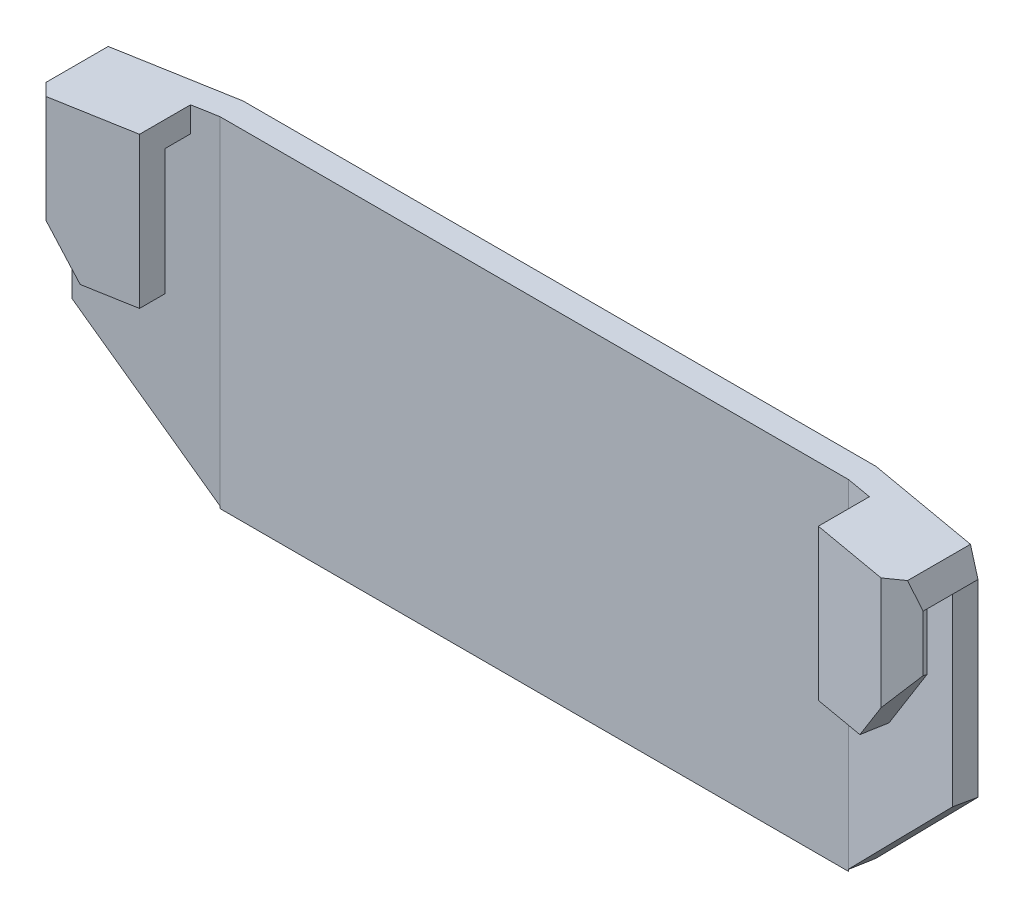
from build123d import *
from OCP.BRepFilletAPI import BRepFilletAPI_MakeChamfer

# Parameters (mm, degrees)
BOSS_EXTRUDE1_DEPTH = 2
BOSS_EXTRUDE2_DEPTH = 25
BOSS_EXTRUDE3_DEPTH = 10
CUT_EXTRUDE4_DEPTH  = 2
CUT_EXTRUDE5_DEPTH  = 2
CUT_EXTRUDE6_DEPTH  = 2
CUT_EXTRUDE7_DEPTH  = 2
CHAMFER1_SIZE       = 0.727940469
CHAMFER1_SIZE_2     = 2
CHAMFER2_SIZE       = 2
CHAMFER2_SIZE2      = 1.72643598


with BuildPart() as part:
    # Sketch12 → Boss-Extrude1 (new body)
    with BuildSketch(Plane(origin=(0, 0, 0), x_dir=(1, 0, 0), z_dir=(0, 1, 0))):
        Polygon((-27, -6.414360409), (-27, -2.352653961), (-25, -2), (25, -2), (27, -2.352653961), (27, -6.414360409), (35.023054857, -7.829041448), (35.023054857, -1.736481777), (25.174977327, 0), (-25.174977327, 0), (-35.023054857, -1.736481777), (-35.023054857, -7.829041448), align=None)
    extrude(amount=BOSS_EXTRUDE1_DEPTH)

    # Sketch13 → Boss-Extrude2 (add)
    with BuildSketch(Plane.XZ):
        Polygon((25.174977327, 0), (35.023054857, 1.736481777), (35.023054857, 3.767335), (27, 2.352653961), (25, 2), (-25, 2), (-27, 2.352653961), (-35.023054857, 3.767335), (-35.023054857, 1.736481777), (-25.174977327, 0), align=None)
    extrude(amount=BOSS_EXTRUDE2_DEPTH)

    # Sketch14 → Boss-Extrude3 (add)
    with BuildSketch(Plane.XZ):
        Polygon((-35.023054857, 7.829041448), (-27, 6.414360409), (-27, 4.383507185), (-35.023054857, 5.798188224), align=None)
        Polygon((27, 6.414360409), (35.023054857, 7.829041448), (35.023054857, 5.798188224), (27, 4.383507185), align=None)
    extrude(amount=BOSS_EXTRUDE3_DEPTH)

    # Sketch15 → Cut-Extrude4 (cut)
    with BuildSketch(Plane(origin=(0.759118452, 0, -4.305174677), x_dir=(-0.9848077530121055, 0, -0.1736481776675121), z_dir=(0.1736481776675121, 0, -0.9848077530121055))):
        Polygon((-24.792512854, -25), (-35.145166815, -14.647346039), (-35.145166815, -25), align=None)
    extrude(amount=-CUT_EXTRUDE4_DEPTH, mode=Mode.SUBTRACT)

    # Sketch16 → Cut-Extrude5 (cut)
    with BuildSketch(Plane(origin=(-0.759118452, 0, -4.305174677), x_dir=(-0.9848077530121054, 0, 0.17364817766751298), z_dir=(-0.17364817766751298, 0, -0.9848077530121054))):
        Polygon((24.792512854, -25), (35.145166815, -14.647346039), (35.145166815, -25), align=None)
    extrude(amount=-CUT_EXTRUDE5_DEPTH, mode=Mode.SUBTRACT)

    # Sketch18 → Cut-Extrude6 (cut)
    with BuildSketch(Plane(origin=(0.282770614, 0, 1.603671841), x_dir=(0.9848077530121053, 0, -0.17364817766751298), z_dir=(0.173648177667513, 0, 0.9848077530121054))):
        Polygon((-31.777063033, -10), (-35.850474738, -4), (-35.850474738, -10), align=None)
    extrude(amount=-CUT_EXTRUDE6_DEPTH, mode=Mode.SUBTRACT)

    # Sketch19 → Cut-Extrude7 (cut)
    with BuildSketch(Plane(origin=(-0.282770614, 0, 1.603671841), x_dir=(0.9848077530121055, 0, 0.17364817766751214), z_dir=(-0.17364817766751214, 0, 0.9848077530121055))):
        Polygon((31.777063033, -10), (35.850474738, -4), (35.850474738, -10), align=None)
    extrude(amount=-CUT_EXTRUDE7_DEPTH, mode=Mode.SUBTRACT)

    # Chamfer1
    chamfer1_edges_1 = [part.edges().sort_by_distance(p)[0] for p in [
        (-35.023054857, 2, 4.782761612),
    ]]
    chamfer1_side_1 = [part.faces().sort_by_distance(p)[0] for p in [
        (-35.008496048, 2, 4.782761612),
    ]]
    chamfer1_edges_2 = [part.edges().sort_by_distance(p)[0] for p in [
        (35.023054857, 2, 4.782761612),
    ]]
    chamfer1_side_2 = [part.faces().sort_by_distance(p)[0] for p in [
        (35.008496048, 2, 4.782761612),
    ]]
    chamfer1 = BRepFilletAPI_MakeChamfer(part.part.solid().wrapped)
    for e in chamfer1_edges_1:
        chamfer1.Add(CHAMFER1_SIZE - 0.0001, CHAMFER1_SIZE_2 - 0.0001, e.wrapped, chamfer1_side_1[0].wrapped)
    for e in chamfer1_edges_2:
        chamfer1.Add(CHAMFER1_SIZE - 0.0001, CHAMFER1_SIZE_2 - 0.0001, e.wrapped, chamfer1_side_2[0].wrapped)
    add(Compound.cast(chamfer1.Shape()), mode=Mode.REPLACE)  # a hair under: the kernel refuses the full size

    # Chamfer2: one chamfer whose edges measure the first distance from different faces: ONE call of the kernel's chamfer builder (chamfer() names one face for all edges)
    chamfer2_edges_1 = [part.edges().sort_by_distance(p)[0] for p in [
        (-35.023054857, -1.99995, 7.829041448),
    ]]
    chamfer2_side_1 = [part.faces().sort_by_distance(p)[0] for p in [
        (-35.023054857, -6.233576758, 3.65083088),
    ]]
    chamfer2_edges_2 = [part.edges().sort_by_distance(p)[0] for p in [
        (35.023054857, -1.99995, 7.829041448),
    ]]
    chamfer2_side_2 = [part.faces().sort_by_distance(p)[0] for p in [
        (30.593302678, -3.470070419, 7.047956621),
    ]]
    chamfer2 = BRepFilletAPI_MakeChamfer(part.part.solid().wrapped)
    for e in chamfer2_edges_1:
        chamfer2.Add(CHAMFER2_SIZE, CHAMFER2_SIZE2, e.wrapped, chamfer2_side_1[0].wrapped)  # the first distance lies on this face
    for e in chamfer2_edges_2:
        chamfer2.Add(CHAMFER2_SIZE, CHAMFER2_SIZE2, e.wrapped, chamfer2_side_2[0].wrapped)  # the first distance lies on this face
    add(Compound.cast(chamfer2.Shape()), mode=Mode.REPLACE)


solid = part.part
